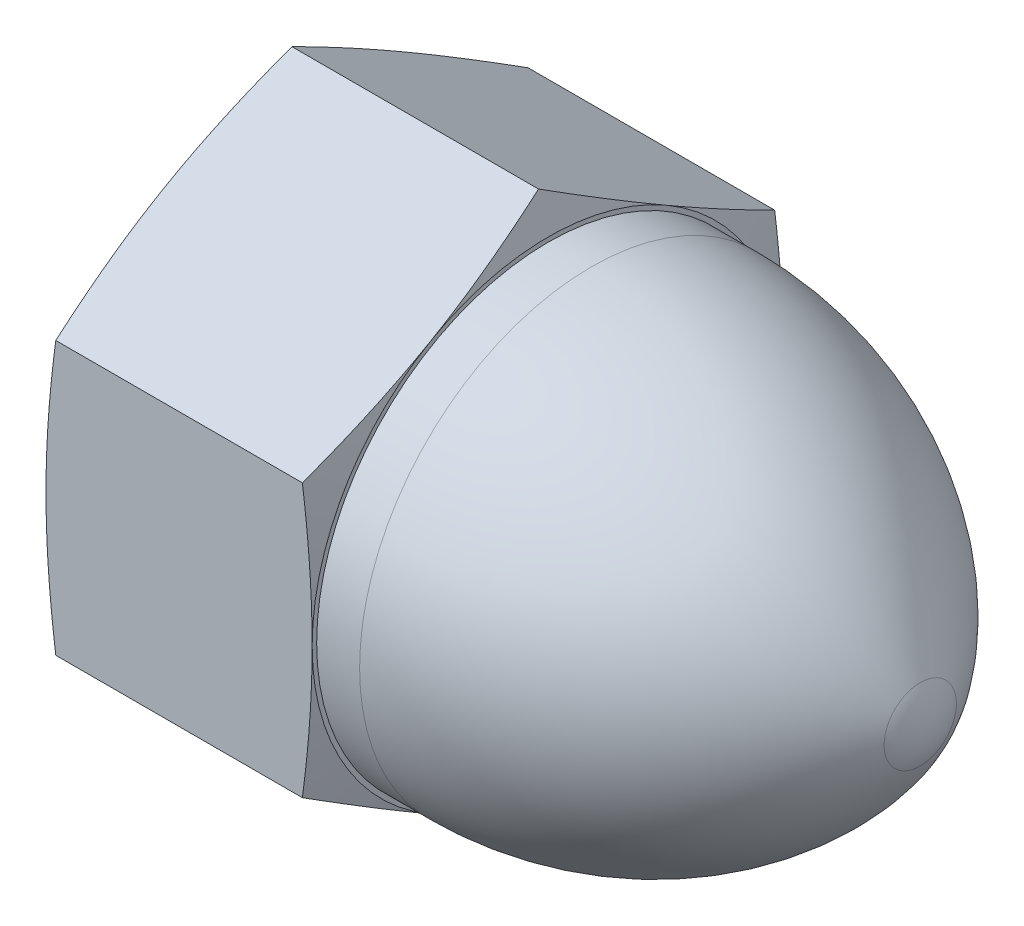
from build123d import *

# Parameters (mm, degrees)
BASENUT_DEPTH = 20.574


with BuildPart() as part:
    # BaseNutSke → BaseNut (new body)
    with BuildSketch(Plane(origin=(0, 0, 0), x_dir=(0, 0, -1), z_dir=(1, 0, 0))):
        Polygon((18.25625, 10.540250852), (18.25625, -10.540250852), (0, -21.080501704), (-18.25625, -10.540250852), (-18.25625, 10.540250852), (0, 21.080501704), align=None)
    extrude(amount=BASENUT_DEPTH)

    # Sketch3 → Crown (revolve)
    with BuildSketch(Plane.XY):
        with BuildLine():
            Line((50.038, 0), (0, 0))
            Line((0, 0), (0, 17.907))
            Line((0, 17.907), (23.89386723, 17.907))
            ThreePointArc((23.89386723, 17.907), (38.686643155, 13.843242093), (49.327308282, 2.792604396))
            ThreePointArc((49.327308282, 2.792604396), (49.857539852, 1.440808977), (50.038, 0))
        make_face()
    revolve(axis=Axis((0, 0, 0), (1, 0, 0)))

    # Sketch4 → DoubleChamfer (revolve, cut)
    with BuildSketch(Plane.XY):
        Polygon((0, 18.25625), (1.949893068, 25.53335), (18.624460993, 25.53335), (20.574, 18.25625), (33.274, 18.25625), (33.274, 43.65625), (-12.7, 43.65625), (-12.7, 18.25625), align=None)
    revolve(axis=Axis((0, 0, 0), (1, 0, 0)), mode=Mode.SUBTRACT)

    # Sketch5 → TapDrill (revolve, cut)
    with BuildSketch(Plane.XY):
        Polygon((0, 11.1125), (35.052, 11.1125), (41.729063629, 0), (0, 0), align=None)
    revolve(axis=Axis((0, 0, 0), (1, 0, 0)), mode=Mode.SUBTRACT)

    # EndChamferSketch → EndChamfer (revolve, cut)
    with BuildSketch(Plane.XY):
        Polygon((-0.0254, 12.7), (0.0254, 12.7), (1.248137414, 10.95375), (-0.0254, 10.95375), align=None)
    revolve(axis=Axis((-3.175, 0, 0), (-1, 0, 0)), mode=Mode.SUBTRACT)


solid = part.part
